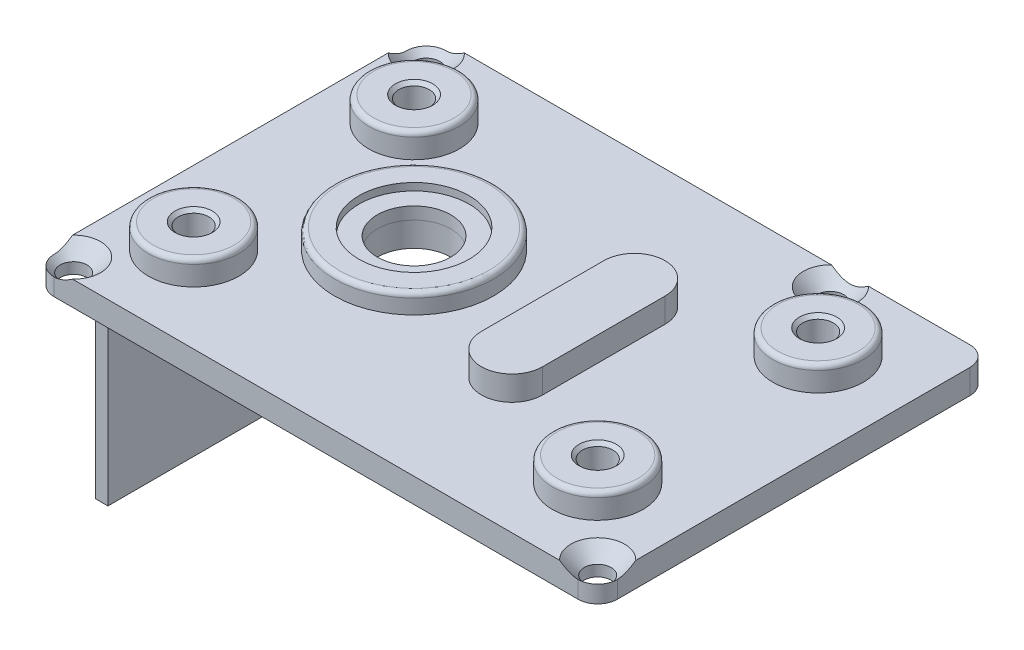
from build123d import *

# Parameters (mm, degrees)
SKETCH2_W                                      = 46
SKETCH2_H                                      = 32
BOSS_EXTRUDE2_DEPTH                            = 2
SKETCH6_R                                      = 3
CUT_EXTRUDE1_DEPTH                             = 35.942810419
SKETCH7_R                                      = 4.5
SKETCH7_R_2                                    = 3
BOSS_EXTRUDE4_DEPTH                            = 1
SKETCH8_R                                      = 6.5
SKETCH8_R_2                                    = 4.5
BOSS_EXTRUDE5_DEPTH                            = 1.6
SKETCH3_R                                      = 3.7
BOSS_EXTRUDE3_DEPTH                            = 2
FILLET3_R                                      = 0.4
LPATTERN1_COUNT                                = 2
LPATTERN1_PITCH                                = 33
BOSS_EXTRUDE6_DEPTH                            = 2
MIRROR2_COPY_1_SKETCH_R                        = 3.7
MIRROR2_COPY_1_DEPTH                           = 2
CSK_FOR_M2_FLAT_HEAD_MACHINE_SCREW1_AT_2_COUNT = 2
CSK_FOR_M2_FLAT_HEAD_MACHINE_SCREW1_AT_2_PITCH = 33
CSK_FOR_M2_FLAT_HEAD_MACHINE_SCREW1_AT_3_COUNT = 2
CSK_FOR_M2_FLAT_HEAD_MACHINE_SCREW1_AT_3_PITCH = 51.587595408
CSK_FOR_M2_FLAT_HEAD_MACHINE_SCREW1_AT_4_COUNT = 2
CSK_FOR_M2_FLAT_HEAD_MACHINE_SCREW1_AT_4_PITCH = 28.8
FILLET1_R                                      = 1.6
SKETCH12_W                                     = 1
SKETCH12_H                                     = 22
BOSS_EXTRUDE7_DEPTH                            = 17.6
FILLET5_R                                      = 0.4


with BuildPart() as part:
    # Sketch2 → Boss-Extrude2 (new body)
    with BuildSketch(Plane(origin=(0, 0, 0), x_dir=(1, 0, 0), z_dir=(0, 1, 0))):
        with Locations((8, 0)):
            Rectangle(SKETCH2_W, SKETCH2_H)
    extrude(amount=BOSS_EXTRUDE2_DEPTH)

    # Sketch6 → Cut-Extrude1 (cut, through all)
    with BuildSketch(Plane(origin=(0, 2, 0), x_dir=(1, 0, 0), z_dir=(0, 1, 0))):
        with Locations(Location((0, 0, 0), (0, 0, 270))):
            Circle(SKETCH6_R)
    extrude(amount=-CUT_EXTRUDE1_DEPTH, mode=Mode.SUBTRACT)

    # Sketch3 → Boss-Extrude3 (add)
    with BuildSketch(Plane(origin=(0, 2, 0), x_dir=(1, 0, 0), z_dir=(0, 1, 0))):
        with Locations(Location((-9, 9, 0), (0, 0, 270))):
            Circle(SKETCH3_R)
    boss_extrude3 = extrude(amount=BOSS_EXTRUDE3_DEPTH)

    # Sketch4 → M3x0.5 Tapped Hole1 (revolve, cut)
    with BuildSketch(Plane(origin=(-9, 4, -9), x_dir=(0, 0, 1), z_dir=(1, 0, 0))):
        Polygon((0, 0), (0, 4), (1.25, 4), (1.25, 0.275), (1.525, 0), align=None)
    m3x0_5_tapped_hole1 = revolve(axis=Axis((-9, 10.35, -9), (0, -1, 0)), mode=Mode.SUBTRACT)

    # LPattern1: Boss-Extrude3, M3x0.5 Tapped Hole1 ×2
    with Locations(*[(i * LPATTERN1_PITCH, 0, 0) for i in range(1, LPATTERN1_COUNT)]):
        add(boss_extrude3)
        add(m3x0_5_tapped_hole1, mode=Mode.SUBTRACT)

    # Sketch9 → Boss-Extrude6 (add)
    with BuildSketch(Plane(origin=(0, 2, 0), x_dir=(1, 0, 0), z_dir=(0, 1, 0))):
        with BuildLine():
            Line((10.5, -5), (10.5, 5))
            ThreePointArc((10.5, 5), (13, 7.5), (15.5, 5))
            Line((15.5, 5), (15.5, -5))
            ThreePointArc((15.5, -5), (13, -7.5), (10.5, -5))
        make_face()
    extrude(amount=BOSS_EXTRUDE6_DEPTH)

    # Mirror2: Boss-Extrude3, M3x0.5 Tapped Hole1 across plane
    add(boss_extrude3.mirror(Plane.XY))
    add(m3x0_5_tapped_hole1.mirror(Plane.XY), mode=Mode.SUBTRACT)

    # Mirror2 copy 1 sketch → Mirror2 copy 1 (add)
    with BuildSketch(Plane(origin=(33, 2, 0), x_dir=(1, 0, 0), z_dir=(0, 1, 0))):
        with Locations((-9, -9)):
            Circle(MIRROR2_COPY_1_SKETCH_R)
    extrude(amount=MIRROR2_COPY_1_DEPTH)

    # Mirror2 copy 2 sketch → Mirror2 copy 2 (revolve, cut)
    with BuildSketch(Plane(origin=(24, 4, 9), x_dir=(0, 0, -1), z_dir=(1, 0, 0))):
        Polygon((0, 0), (0, -4), (1.25, -4), (1.25, -0.275), (1.525, 0), align=None)
    revolve(axis=Axis((24, 10.35, 9), (0, 1, 0)), mode=Mode.SUBTRACT)

    # Sketch10 → CSK for M2 Flat Head Machine Screw1 (revolve, cut)
    with BuildSketch(Plane(origin=(-13.4, 2, -14.4), x_dir=(0, 0, 1), z_dir=(1, 0, 0))):
        Polygon((0, 0), (0, 2), (1.1, 2), (1.1, 1.1), (2.2, 0), align=None)
    csk_for_m2_flat_head_machine_screw1 = revolve(axis=Axis((-13.4, 8.35, -14.4), (0, -1, 0)), mode=Mode.SUBTRACT)

    # CSK for M2 Flat Head Machine Screw1 at 2: CSK for M2 Flat Head Machine Screw1 ×2
    with Locations(*[(i * CSK_FOR_M2_FLAT_HEAD_MACHINE_SCREW1_AT_2_PITCH, 0, 0) for i in range(1, CSK_FOR_M2_FLAT_HEAD_MACHINE_SCREW1_AT_2_COUNT)]):
        add(csk_for_m2_flat_head_machine_screw1, mode=Mode.SUBTRACT)

    # CSK for M2 Flat Head Machine Screw1 at 3: CSK for M2 Flat Head Machine Screw1 ×2
    with Locations(*[Vector(0.8296568130639779, 0, 0.5582737433701533) * (i * CSK_FOR_M2_FLAT_HEAD_MACHINE_SCREW1_AT_3_PITCH) for i in range(1, CSK_FOR_M2_FLAT_HEAD_MACHINE_SCREW1_AT_3_COUNT)]):
        add(csk_for_m2_flat_head_machine_screw1, mode=Mode.SUBTRACT)

    # CSK for M2 Flat Head Machine Screw1 at 4: CSK for M2 Flat Head Machine Screw1 ×2
    with Locations(*[(0, 0, i * CSK_FOR_M2_FLAT_HEAD_MACHINE_SCREW1_AT_4_PITCH) for i in range(1, CSK_FOR_M2_FLAT_HEAD_MACHINE_SCREW1_AT_4_COUNT)]):
        add(csk_for_m2_flat_head_machine_screw1, mode=Mode.SUBTRACT)

    # Fillet1
    fillet1_edges = [part.edges().sort_by_distance(p)[0] for p in [
        (31, 1, -16),
        (31, 1, 16),
        (-15, 1, -16),
        (-15, 1, 16),
    ]]
    fillet(fillet1_edges, radius=FILLET1_R - 0.0001)  # a hair under: the kernel refuses the full size

    # Sketch12 → Boss-Extrude7 (add)
    with BuildSketch(Plane.XZ):
        with Locations((-14.5, 0)):
            Rectangle(SKETCH12_W, SKETCH12_H)
    extrude(amount=BOSS_EXTRUDE7_DEPTH)

    # Fillet5
    fillet5_edges = [part.edges().sort_by_distance(p)[0] for p in [
        (-9, 4, -12.7),
        (24, 4, -12.7),
        (-9, 4, 12.7),
        (20.3, 4, 9),
    ]]
    fillet(fillet5_edges, radius=FILLET5_R)


with BuildPart() as body_2:
    # Sketch7 → Boss-Extrude4 (new body)
    with BuildSketch(Plane(origin=(0, 2, 0), x_dir=(1, 0, 0), z_dir=(0, 1, 0))):
        with Locations(Location((0, 0, 0), (0, 0, 270))):
            Circle(SKETCH7_R)
        with Locations(Location((0, 0, 0), (0, 0, 270))):
            Circle(SKETCH7_R_2, mode=Mode.SUBTRACT)
    extrude(amount=BOSS_EXTRUDE4_DEPTH)


with BuildPart() as body_3:
    # Sketch8 → Boss-Extrude5 (new body)
    with BuildSketch(Plane(origin=(0, 2, 0), x_dir=(1, 0, 0), z_dir=(0, 1, 0))):
        with Locations(Location((0, 0, 0), (0, 0, 270))):
            Circle(SKETCH8_R)
        with Locations(Location((0, 0, 0), (0, 0, 270))):
            Circle(SKETCH8_R_2, mode=Mode.SUBTRACT)
    extrude(amount=BOSS_EXTRUDE5_DEPTH)

    # Fillet3
    fillet3_edges = [body_3.edges().sort_by_distance(p)[0] for p in [
        (0, 3.6, -6.5),
    ]]
    fillet(fillet3_edges, radius=FILLET3_R)


solid = Compound([part.part, body_2.part, body_3.part])
